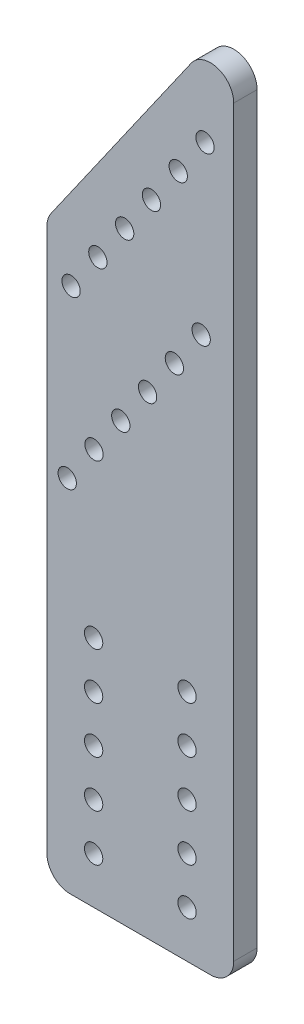
from build123d import *

# Parameters (mm, degrees)
BOSS_EXTRUDE1_DEPTH = 6.35
SKETCH2_R           = 2.4892
CUT_EXTRUDE1_DEPTH  = 235.26250767
FILLET1_R           = 6.35


with BuildPart() as part:
    # Sketch1 → Boss-Extrude1 (new body)
    with BuildSketch(Plane.XY):
        Polygon((0, 156.050081258), (50.8, 228.6), (50.8, 0), (0, 0), align=None)
    extrude(amount=BOSS_EXTRUDE1_DEPTH)

    # Sketch2 → Cut-Extrude1 (cut, through all)
    with BuildSketch(Plane(origin=(0, 0, 0), x_dir=(-1, 0, 0), z_dir=(0, 0, -1))):
        with Locations((-38.1, 12.7)):
            Circle(SKETCH2_R)
        with Locations((-12.7, 12.7)):
            Circle(SKETCH2_R)
        with Locations((-12.7, 25.4)):
            Circle(SKETCH2_R)
        with Locations((-38.1, 25.4)):
            Circle(SKETCH2_R)
        with Locations((-12.7, 38.1)):
            Circle(SKETCH2_R)
        with Locations((-38.1, 38.1)):
            Circle(SKETCH2_R)
        with Locations((-12.7, 50.8)):
            Circle(SKETCH2_R)
        with Locations((-38.1, 50.8)):
            Circle(SKETCH2_R)
        with Locations((-12.7, 63.5)):
            Circle(SKETCH2_R)
        with Locations((-38.1, 63.5)):
            Circle(SKETCH2_R)
        with Locations((-42.992179108, 195.307501852)):
            Circle(SKETCH2_R)
        with Locations((-35.707758367, 184.90427089)):
            Circle(SKETCH2_R)
        with Locations((-28.423337625, 174.501039927)):
            Circle(SKETCH2_R)
        with Locations((-21.138916883, 164.097808965)):
            Circle(SKETCH2_R)
        with Locations((-41.945378808, 149.528967481)):
            Circle(SKETCH2_R)
        with Locations((-13.854496142, 153.694578002)):
            Circle(SKETCH2_R)
        with Locations((-34.660958067, 139.125736519)):
            Circle(SKETCH2_R)
        with Locations((-6.5700754, 143.29134704)):
            Circle(SKETCH2_R)
        with Locations((-27.376537325, 128.722505556)):
            Circle(SKETCH2_R)
        with Locations((-20.092116583, 118.319274594)):
            Circle(SKETCH2_R)
        with Locations((-12.807695842, 107.916043632)):
            Circle(SKETCH2_R)
        with Locations((-5.5232751, 97.512812669)):
            Circle(SKETCH2_R)
    extrude(amount=-CUT_EXTRUDE1_DEPTH, mode=Mode.SUBTRACT)

    # Fillet1
    fillet1_edges = [part.edges().sort_by_distance(p)[0] for p in [
        (0, 156.050081258, 3.175),
        (50.8, 0, 3.175),
        (0, 0, 3.175),
        (50.8, 228.6, 3.175),
    ]]
    fillet(fillet1_edges, radius=FILLET1_R)


solid = part.part
